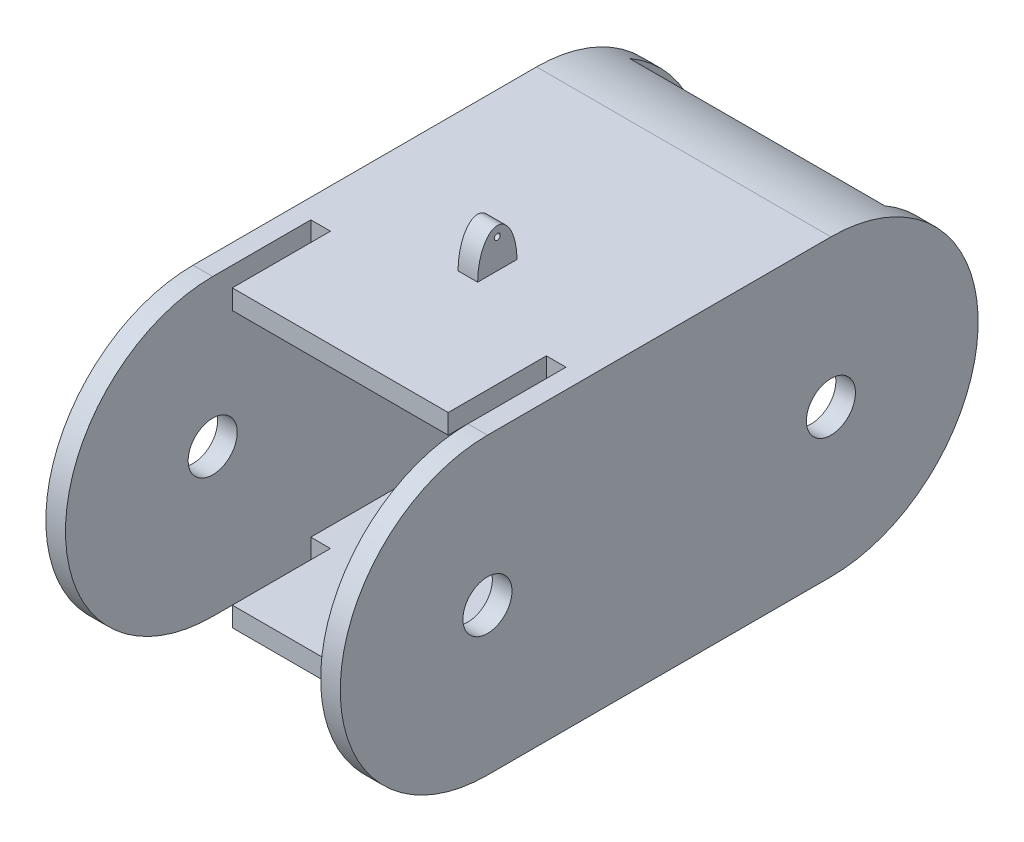
from build123d import *

# Parameters (mm, degrees)
SKETCH1_W           = 19.05
SKETCH1_H           = 41.275
BOSS_EXTRUDE1_DEPTH = 19.05
SKETCH2_W           = 16.51
SKETCH2_H           = 16.51
CUT_EXTRUDE1_DEPTH  = 50.8
SKETCH3_W           = 1.27
SKETCH3_H           = 2.54
BOSS_EXTRUDE2_DEPTH = 2.54
SKETCH4_R           = 0.1905
SKETCH4_R_2         = 1.5875
CUT_EXTRUDE2_DEPTH  = 19.05
CUT_EXTRUDE3_DEPTH  = 25.4


with BuildPart() as part:
    # Sketch1 → Boss-Extrude1 (new body)
    with BuildSketch(Plane(origin=(0, 0, 0), x_dir=(1, 0, 0), z_dir=(0, 1, 0))):
        with Locations((9.525, 20.6375)):
            Rectangle(SKETCH1_W, SKETCH1_H)
    extrude(amount=BOSS_EXTRUDE1_DEPTH)

    # Sketch2 → Cut-Extrude1 (cut)
    with BuildSketch(Plane.XY):
        with Locations((9.525, 9.525)):
            Rectangle(SKETCH2_W, SKETCH2_H)
    extrude(amount=-CUT_EXTRUDE1_DEPTH, mode=Mode.SUBTRACT)

    # Sketch3 → Boss-Extrude2 (add)
    with BuildSketch(Plane(origin=(0, 19.05, 0), x_dir=(1, 0, 0), z_dir=(0, 1, 0))):
        with Locations((9.525, 19.05)):
            Rectangle(SKETCH3_W, SKETCH3_H)
    extrude(amount=BOSS_EXTRUDE2_DEPTH)

    # Sketch4 → Cut-Extrude2 (cut)
    with BuildSketch(Plane(origin=(0, 0, 0), x_dir=(0, 0, -1), z_dir=(1, 0, 0))):
        with Locations((19.05, 20.955)):
            Circle(SKETCH4_R)
        with Locations((9.525, 9.525)):
            Circle(SKETCH4_R_2)
        with BuildLine():
            ThreePointArc((20.32, 19.05), (19.05, 22.337330126), (17.78, 19.05))
            add(Edge.make_bspline(
                [(20.32, 19.05), (20.32, 21.59), (19.05, 21.59), (17.78, 21.59), (17.78, 19.05)],
                knots=[4.71238898, 4.71238898, 4.71238898, 6.283185307, 6.283185307, 7.853981634, 7.853981634, 7.853981634], degree=2, weights=[1, 0.707106781, 1, 0.707106781, 1]))
        make_face()
        with BuildLine():
            ThreePointArc((9.525, 19.05), (0, 9.525), (9.525, 0))
            ThreePointArc((9.525, 0), (-6.861844225, 9.525), (9.525, 19.05))
        make_face()
    cut_extrude2 = extrude(amount=CUT_EXTRUDE2_DEPTH, mode=Mode.SUBTRACT)

    # Mirror1: Cut-Extrude2 across plane
    add(cut_extrude2.mirror(Plane.XY.offset(-20.6375)), mode=Mode.SUBTRACT)

    # Sketch7 → Cut-Extrude3 (cut)
    with BuildSketch(Plane(origin=(0, 19.05, 0), x_dir=(1, 0, 0), z_dir=(0, 1, 0))):
        Polygon((2.54, 9.525), (16.51, 9.525), (16.51, 15.875), (17.78, 15.875), (17.78, 0), (16.51, 0), (2.54, 0), (1.27, 0), (1.27, 15.875), (2.54, 15.875), align=None)
    extrude(amount=-CUT_EXTRUDE3_DEPTH, mode=Mode.SUBTRACT)


solid = part.part
